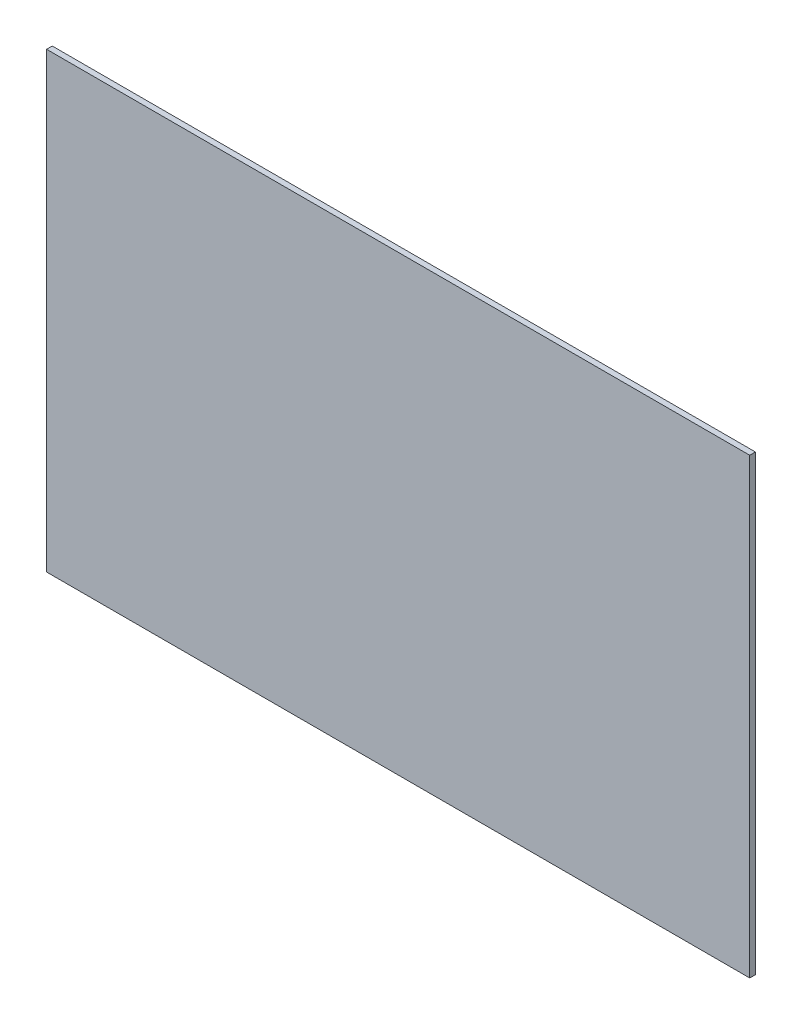
from build123d import *

# Parameters (mm, degrees)
SKETCH3_W           = 393.7
SKETCH3_H           = 253.492
BOSS_EXTRUDE1_DEPTH = 1.5875


with BuildPart() as part:
    # Sketch3 → Boss-Extrude1 (new, symmetric)
    with BuildSketch(Plane.XY):
        Rectangle(SKETCH3_W, SKETCH3_H)
    extrude(amount=BOSS_EXTRUDE1_DEPTH, both=True)


solid = part.part
